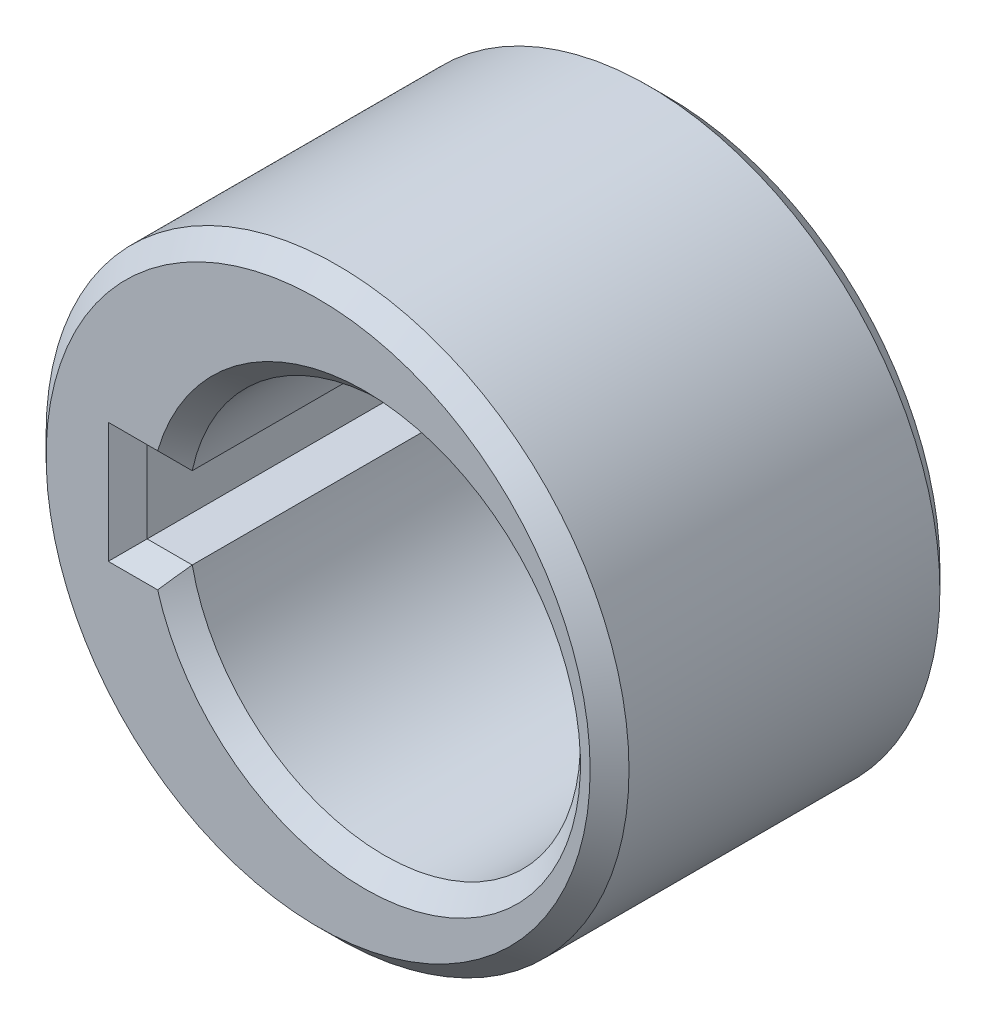
from build123d import *

# Parameters (mm, degrees)
SKETCH1_R           = 7.5
SKETCH1_R_2         = 5.05
BOSS_EXTRUDE1_DEPTH = 9
SKETCH2_W           = 6.1
SKETCH2_H           = 2.1
CUT_EXTRUDE1_DEPTH  = 15.592463808
CHAMFER1_SIZE       = 0.5
CHAMFER2_SIZE       = 0.5
CHAMFER3_SIZE       = 0.5


with BuildPart() as part:
    # Sketch1 → Boss-Extrude1 (new body)
    with BuildSketch(Plane.XY):
        with Locations((-1.2, 0)):
            Circle(SKETCH1_R)
        Circle(SKETCH1_R_2, mode=Mode.SUBTRACT)
    extrude(amount=BOSS_EXTRUDE1_DEPTH)

    # Sketch2 → Cut-Extrude1 (cut, through all)
    with BuildSketch(Plane.XY.offset(9)):
        with Locations((-3.05, 0)):
            Rectangle(SKETCH2_W, SKETCH2_H)
    extrude(amount=-CUT_EXTRUDE1_DEPTH, mode=Mode.SUBTRACT)

    # Chamfer1
    chamfer1_edges = [part.edges().sort_by_distance(p)[0] for p in [
        (-6.1, 0, 9),
        (-5.519817807, 1.05, 9),
        (-5.519817807, -1.05, 9),
        (5.05, 0, 9),
    ]]
    chamfer(chamfer1_edges, length=CHAMFER1_SIZE)

    # Chamfer2
    chamfer2_edges = [part.edges().sort_by_distance(p)[0] for p in [
        (5.05, 0, 0),
        (-5.519817807, -1.05, 0),
        (-5.519817807, 1.05, 0),
        (-6.1, 0, 0),
    ]]
    chamfer(chamfer2_edges, length=CHAMFER2_SIZE)

    # Chamfer3
    chamfer3_edges = [part.edges().sort_by_distance(p)[0] for p in [
        (-8.7, 0, 0),
        (-8.7, 0, 9),
    ]]
    chamfer(chamfer3_edges, length=CHAMFER3_SIZE)


solid = part.part
